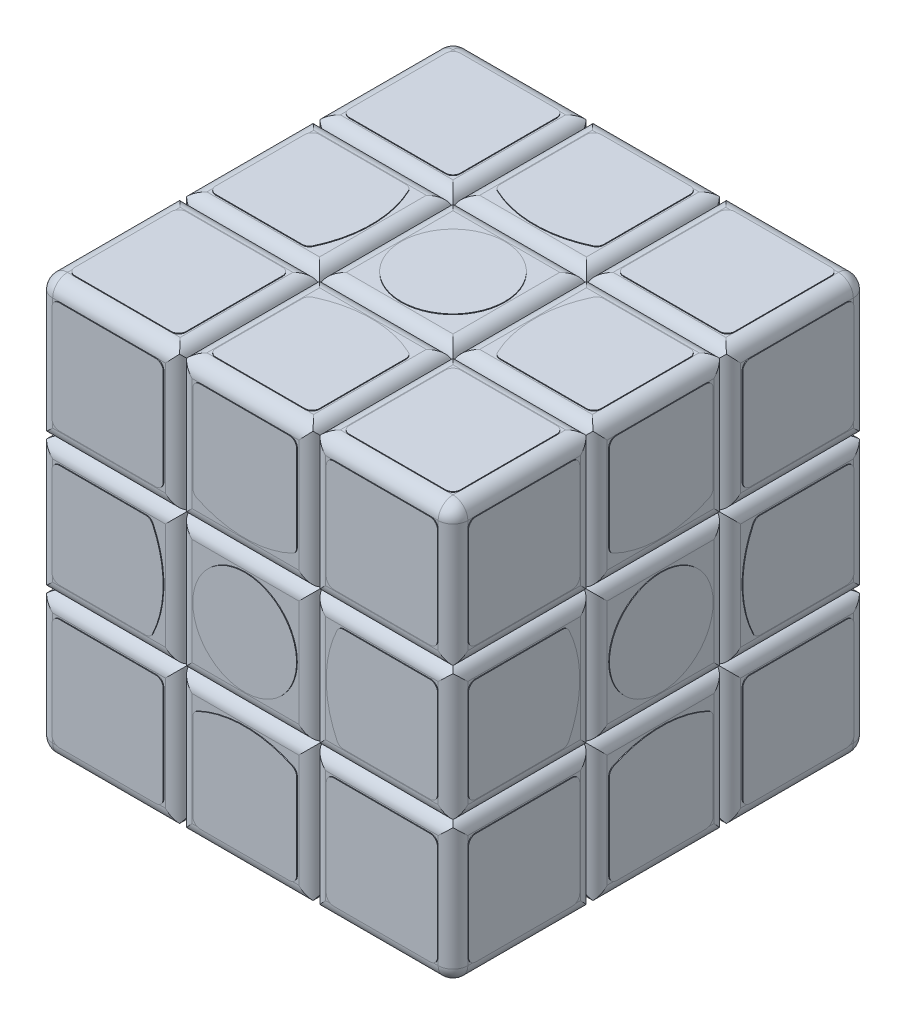
from build123d import *

# Parameters (mm, degrees)
EXTRUDE_1_DEPTH          = 28
FILLET_1_R               = 2
SKETCH_2_R               = 7.000000000000157
EXTRUDE_2_DEPTH          = 0.1
SKETCH_5_R               = 7.000000000000157
EXTRUDE_3_DEPTH          = 0.1
SKETCH_4_R               = 7.000000000000156
EXTRUDE_4_DEPTH          = 0.1
CUT_EXTRUDE_1_DEPTH      = 69.66745954234801
CUT_EXTRUDE_1_DEPTH_BACK = 69.66745954234801
CUT_EXTRUDE_12_DEPTH     = 69.66745962390216
CUT_EXTRUDE_11_DEPTH     = 69.66745962390215


with BuildPart() as part:
    # 草图1 → 凸台-拉伸1 (new, symmetric)
    with BuildSketch(Plane.XY):
        Polygon((27.99999999999999, -27.999999999999982), (-28.00000000000001, -27.99999999999999), (-28.00000000000001, 28.00000000000001), (27.99999999999999, 28.000000000000018), align=None)
    extrude(amount=EXTRUDE_1_DEPTH, both=True)

    # 圆角1
    fillet_1_edges = [part.edges().sort_by_distance(p)[0] for p in [
        (-1.066e-14, 28.000000000000014, 28),
        (-1.066e-14, 28.000000000000014, -28),
        (27.99999999999999, 1.776e-14, 28),
        (-1.066e-14, -27.999999999999986, 28),
        (-28.00000000000001, 1.066e-14, 28),
        (-1.066e-14, -27.999999999999986, -28),
        (27.99999999999999, 1.776e-14, -28),
        (-28.00000000000001, 1.066e-14, -28),
        (27.99999999999999, 28.000000000000018, 0),
        (-28.00000000000001, 28.00000000000001, 0),
        (27.99999999999999, -27.999999999999982, 0),
        (-28.00000000000001, -27.99999999999999, 0),
    ]]
    fillet(fillet_1_edges, radius=FILLET_1_R)

    # 草图2 → 凸台-拉伸2 (add)
    with BuildSketch(Plane(origin=(-3.47e-15, 28.000000000000014, 0), x_dir=(0, 0, -1), z_dir=(-1.6e-16, 1, 0))):
        with BuildLine():
            Line((13.350889359326443, -7.000000000000065), (24.999999999999968, -7.000000000000104))
            ThreePointArc((24.999999999999968, -7.000000000000104), (25.707106781186525, -6.707106781186655), (25.99999999999998, -6.000000000000101))
            Line((25.99999999999998, -6.0000000000001), (26.000000000000025, 5.999999999999917))
            ThreePointArc((26.000000000000025, 5.999999999999917), (25.707106781186575, 6.707106781186473), (25.00000000000002, 6.999999999999928))
            Line((25.00000000000002, 6.999999999999929), (13.35088935932649, 6.999999999999966))
            ThreePointArc((13.35088935932649, 6.999999999999967), (12.816366875501643, 6.8451542547284845), (12.447381456421239, 6.428571428571398))
            ThreePointArc((12.44738145642124, 6.428571428571397), (10.999999999999984, -4.086e-14), (12.447381456421194, -6.428571428571489))
            ThreePointArc((12.447381456421194, -6.42857142857149), (12.816366875501595, -6.8451542547285795), (13.350889359326443, -7.000000000000065))
        make_face()
        with BuildLine():
            Line((26.00000000000033, -24.999999999999666), (26.000000000000323, -11.999999999999664))
            ThreePointArc((26.000000000000323, -11.999999999999664), (25.70710678118687, -11.292893218813116), (25.000000000000323, -10.999999999999664))
            Line((25.000000000000323, -10.999999999999664), (11.999999999999945, -11.00000000000009))
            ThreePointArc((11.999999999999945, -11.00000000000009), (11.292893218813388, -11.29289321881354), (10.99999999999993, -12.000000000000092))
            Line((10.99999999999993, -12.000000000000092), (11.000000000000334, -24.99999999999967))
            ThreePointArc((11.000000000000334, -24.99999999999967), (11.292893218813788, -25.707106781186216), (12.000000000000334, -25.99999999999967))
            Line((12.000000000000334, -25.99999999999967), (25.00000000000033, -25.999999999999666))
            ThreePointArc((25.00000000000033, -25.999999999999666), (25.707106781186877, -25.707106781186212), (26.00000000000033, -24.999999999999666))
        make_face()
        with BuildLine():
            ThreePointArc((25.00000000000004, 10.999999999999934), (25.707106781186596, 11.292893218813383), (26.00000000000005, 11.999999999999936))
            Line((26.00000000000005, 11.999999999999936), (26.000000000000096, 24.999999999999915))
            ThreePointArc((26.000000000000096, 24.999999999999915), (25.707106781186646, 25.70710678118647), (25.000000000000092, 25.999999999999925))
            Line((25.000000000000092, 25.999999999999925), (12.000000000000105, 25.99999999999997))
            ThreePointArc((12.000000000000105, 25.99999999999997), (11.29289321881355, 25.70710678118652), (11.000000000000096, 24.999999999999968))
            Line((11.000000000000094, 24.999999999999968), (11.00000000000005, 11.999999999999986))
            ThreePointArc((11.00000000000005, 11.999999999999986), (11.292893218813498, 11.292893218813429), (12.000000000000053, 10.999999999999975))
            Line((12.000000000000053, 10.999999999999975), (25.00000000000004, 10.999999999999932))
        make_face()
        with BuildLine():
            Line((-5.9999999999992975, -26.000000000000377), (6.0000000000007345, -26.000000000000377))
            ThreePointArc((6.0000000000007345, -26.000000000000377), (6.7071067811872815, -25.707106781186923), (7.000000000000735, -25.000000000000377))
            Line((7.0000000000007345, -25.000000000000377), (6.99999999999992, -13.350889359326514))
            ThreePointArc((6.99999999999992, -13.350889359326514), (6.84515425472844, -12.816366875501664), (6.428571428571355, -12.44738145642126))
            ThreePointArc((6.428571428571354, -12.447381456421262), (-7.86e-14, -11.000000000000403), (-6.428571428571532, -12.447381456421173))
            ThreePointArc((-6.428571428571534, -12.447381456421173), (-6.845154254728624, -12.81636687550157), (-7.00000000000011, -13.350889359326418))
            Line((-7.000000000000111, -13.350889359326418), (-6.999999999999298, -25.000000000000377))
            ThreePointArc((-6.9999999999992975, -25.000000000000377), (-6.707106781185845, -25.707106781186923), (-5.999999999999298, -26.000000000000377))
        make_face()
        with BuildLine():
            ThreePointArc((7.000000000000017, 24.99999999999999), (6.7071067811865674, 25.707106781186546), (6.000000000000011, 26))
            Line((6.000000000000011, 26), (-6.000000000000009, 26.000000000000007))
            ThreePointArc((-6.000000000000009, 26.000000000000007), (-6.707106781186563, 25.70710678118655), (-7.000000000000018, 24.999999999999996))
            Line((-7.000000000000017, 24.999999999999996), (-7.000000000000013, 13.350889359326466))
            ThreePointArc((-7.000000000000013, 13.350889359326466), (-6.845154254728529, 12.816366875501618), (-6.428571428571441, 12.447381456421216))
            ThreePointArc((-6.428571428571441, 12.447381456421214), (4e-15, 10.999999999999982), (6.428571428571448, 12.447381456421219))
            ThreePointArc((6.428571428571447, 12.447381456421217), (6.845154254728535, 12.816366875501618), (7.000000000000019, 13.350889359326468))
            Line((7.000000000000019, 13.350889359326468), (7.000000000000017, 24.99999999999999))
        make_face()
        with BuildLine():
            Line((-24.999999999999677, -26.000000000000004), (-12.000000000000282, -25.999999999999883))
            ThreePointArc((-12.000000000000282, -25.999999999999883), (-11.292893218813726, -25.707106781186436), (-11.000000000000266, -24.999999999999886))
            Line((-11.000000000000266, -24.999999999999886), (-11.00000000000013, -11.999999999999908))
            ThreePointArc((-11.00000000000013, -11.999999999999908), (-11.292893218813573, -11.292893218813349), (-12.000000000000126, -10.99999999999989))
            Line((-12.000000000000126, -10.99999999999989), (-25.000000000000114, -10.999999999999755))
            ThreePointArc((-25.000000000000114, -10.999999999999753), (-25.70710678118667, -11.2928932188132), (-26.00000000000013, -11.999999999999751))
            Line((-26.00000000000013, -11.999999999999751), (-25.999999999999677, -25))
            ThreePointArc((-25.999999999999673, -25), (-25.707106781186226, -25.70710678118655), (-24.999999999999677, -26.000000000000007))
        make_face()
        with BuildLine():
            ThreePointArc((-11.000000000000012, 25), (-11.292893218813468, 25.707106781186557), (-12.000000000000023, 26.00000000000001))
            Line((-12.000000000000023, 26.00000000000001), (-25, 26.00000000000001))
            ThreePointArc((-25, 26.00000000000001), (-25.707106781186557, 25.707106781186557), (-26.00000000000001, 25))
            Line((-26.00000000000001, 25), (-26.00000000000001, 12.000000000000014))
            ThreePointArc((-26.00000000000001, 12.000000000000014), (-25.707106781186557, 11.29289321881346), (-25, 11.000000000000009))
            Line((-25, 11.000000000000009), (-12.000000000000021, 11.000000000000009))
            ThreePointArc((-12.000000000000021, 11.000000000000009), (-11.292893218813465, 11.29289321881346), (-11.000000000000012, 12.000000000000016))
            Line((-11.000000000000012, 12.000000000000016), (-11.000000000000014, 25))
        make_face()
        with BuildLine():
            Line((-25.999999999999936, 6.0000000000002816), (-26.000000000000068, -5.999999999999736))
            ThreePointArc((-26.000000000000068, -5.999999999999736), (-25.707106781186624, -6.707106781186295), (-25.00000000000007, -6.999999999999754))
            Line((-25.00000000000007, -6.999999999999755), (-13.350889359326539, -6.999999999999874))
            ThreePointArc((-13.350889359326539, -6.999999999999874), (-12.81636687550169, -6.845154254728395), (-12.447381456421283, -6.428571428571312))
            ThreePointArc((-12.447381456421285, -6.428571428571312), (-10.999999999999984, 1.1768e-13), (-12.447381456421152, 6.428571428571576))
            ThreePointArc((-12.44738145642115, 6.428571428571577), (-12.816366875501547, 6.845154254728669), (-13.350889359326395, 7.000000000000158))
            Line((-13.350889359326395, 7.000000000000158), (-24.99999999999992, 7.000000000000279))
            ThreePointArc((-24.99999999999992, 7.000000000000278), (-25.707106781186475, 6.707106781186834), (-25.999999999999936, 6.000000000000282))
        make_face()
        Circle(SKETCH_2_R)
    extrude_2 = extrude(amount=EXTRUDE_2_DEPTH)

    # 草图5 → 凸台-拉伸3 (add)
    with BuildSketch(Plane(origin=(0, 0, -28), x_dir=(-1, 0, 0), z_dir=(0, 0, -1))):
        Circle(SKETCH_5_R)
        with BuildLine():
            Line((24.999999999999968, -7.000000000000105), (13.350889359326443, -7.000000000000067))
            ThreePointArc((13.350889359326443, -7.000000000000067), (12.816366875501595, -6.845154254728582), (12.447381456421194, -6.428571428571494))
            ThreePointArc((12.447381456421194, -6.428571428571494), (10.99999999999998, -4.521e-14), (12.447381456421239, 6.428571428571396))
            ThreePointArc((12.447381456421239, 6.428571428571396), (12.816366875501641, 6.845154254728483), (13.35088935932649, 6.9999999999999645))
            Line((13.35088935932649, 6.9999999999999645), (25.00000000000002, 6.999999999999928))
            ThreePointArc((25.00000000000002, 6.999999999999928), (25.707106781186575, 6.707106781186473), (26.000000000000025, 5.9999999999999165))
            Line((26.000000000000025, 5.9999999999999165), (25.99999999999998, -6.000000000000104))
            ThreePointArc((25.99999999999998, -6.000000000000104), (25.70710678118652, -6.707106781186655), (24.999999999999968, -7.000000000000105))
        make_face()
        with BuildLine():
            Line((-25, 26.00000000000001), (-12.000000000000025, 26.00000000000001))
            ThreePointArc((-12.000000000000025, 26.00000000000001), (-11.292893218813468, 25.707106781186557), (-11.000000000000016, 25))
            Line((-11.000000000000016, 25), (-11.000000000000016, 12.000000000000014))
            ThreePointArc((-11.000000000000016, 12.000000000000014), (-11.292893218813468, 11.292893218813457), (-12.000000000000025, 11.000000000000007))
            Line((-12.000000000000025, 11.000000000000007), (-25, 11.000000000000007))
            ThreePointArc((-25, 11.000000000000007), (-25.707106781186557, 11.292893218813456), (-26.00000000000001, 12.000000000000012))
            Line((-26.00000000000001, 12.000000000000012), (-26.00000000000001, 25))
            ThreePointArc((-26.00000000000001, 25), (-25.707106781186557, 25.707106781186557), (-25, 26.00000000000001))
        make_face()
        with BuildLine():
            Line((-6.999999999999298, -25.000000000000377), (-6.999999999999298, -13.350889359326422))
            ThreePointArc((-6.999999999999298, -13.350889359326422), (-6.845154254727811, -12.816366875501574), (-6.428571428570722, -12.447381456421175))
            ThreePointArc((-6.428571428570722, -12.447381456421175), (6.5338e-13, -10.999999999999671), (6.428571428572166, -12.447381456420567))
            ThreePointArc((6.428571428572166, -12.447381456420567), (6.845154254729438, -12.816366875501265), (7.0000000000007345, -13.350889359326516))
            Line((7.0000000000007345, -13.350889359326516), (7.0000000000007345, -25.000000000000377))
            ThreePointArc((7.0000000000007345, -25.000000000000377), (6.7071067811872815, -25.707106781186926), (6.000000000000734, -26.000000000000377))
            Line((6.000000000000734, -26.000000000000377), (-5.9999999999992975, -26.000000000000377))
            ThreePointArc((-5.9999999999992975, -26.000000000000377), (-6.7071067811858445, -25.707106781186923), (-6.999999999999298, -25.000000000000377))
        make_face()
        with BuildLine():
            Line((12.000000000000105, 25.999999999999968), (25.000000000000092, 25.999999999999925))
            ThreePointArc((25.000000000000092, 25.999999999999925), (25.707106781186646, 25.707106781186468), (26.000000000000096, 24.99999999999991))
            Line((26.000000000000096, 24.99999999999991), (26.00000000000005, 11.999999999999934))
            ThreePointArc((26.00000000000005, 11.999999999999934), (25.707106781186596, 11.292893218813381), (25.00000000000004, 10.99999999999993))
            Line((25.00000000000004, 10.99999999999993), (12.000000000000053, 10.999999999999973))
            ThreePointArc((12.000000000000053, 10.999999999999973), (11.292893218813498, 11.292893218813427), (11.00000000000005, 11.999999999999984))
            Line((11.00000000000005, 11.999999999999984), (11.000000000000094, 24.999999999999968))
            ThreePointArc((11.000000000000094, 24.999999999999968), (11.29289321881355, 25.707106781186518), (12.000000000000105, 25.999999999999968))
        make_face()
        with BuildLine():
            Line((26.000000000000323, -11.999999999999666), (26.00000000000033, -24.99999999999967))
            ThreePointArc((26.00000000000033, -24.99999999999967), (25.707106781186877, -25.707106781186216), (25.00000000000033, -25.99999999999967))
            Line((25.00000000000033, -25.99999999999967), (12.000000000000334, -25.99999999999967))
            ThreePointArc((12.000000000000334, -25.99999999999967), (11.292893218813786, -25.707106781186216), (11.000000000000334, -24.99999999999967))
            Line((11.000000000000334, -24.99999999999967), (11.000000000000334, -12.000000000000096))
            ThreePointArc((11.000000000000334, -12.000000000000096), (11.292893218814076, -11.292893218813255), (12.000000000001155, -11.00000000000009))
            Line((12.000000000001155, -11.00000000000009), (25.000000000001535, -11.00000000000009))
            ThreePointArc((25.000000000001535, -11.00000000000009), (25.70710678118721, -11.292893218813761), (26.000000000000323, -11.999999999999666))
        make_face()
        with BuildLine():
            Line((-12.00000000000028, -25.999999999999883), (-24.999999999999677, -26.000000000000004))
            ThreePointArc((-24.999999999999677, -26.000000000000004), (-25.707106781186226, -25.70710678118655), (-25.999999999999677, -25))
            Line((-25.999999999999677, -25), (-25.999999999999677, -11.999999999999755))
            ThreePointArc((-25.999999999999677, -11.999999999999755), (-25.707106781186216, -11.2928932188132), (-24.999999999999655, -10.999999999999755))
            Line((-24.999999999999655, -10.999999999999755), (-11.999999999999671, -10.999999999999755))
            ThreePointArc((-11.999999999999671, -10.999999999999755), (-11.292893218813315, -11.292893218813415), (-11.000000000000128, -11.999999999999908))
            Line((-11.000000000000128, -11.999999999999908), (-11.000000000000266, -24.99999999999989))
            ThreePointArc((-11.000000000000266, -24.99999999999989), (-11.292893218813727, -25.707106781186436), (-12.00000000000028, -25.999999999999883))
        make_face()
        with BuildLine():
            Line((-6.000000000000012, 26.000000000000004), (6.000000000000011, 25.999999999999996))
            ThreePointArc((6.000000000000011, 25.999999999999996), (6.707106781186567, 25.707106781186543), (7.000000000000017, 24.999999999999986))
            Line((7.000000000000017, 24.999999999999986), (7.000000000000019, 13.350889359326466))
            ThreePointArc((7.000000000000019, 13.350889359326466), (6.845154254728535, 12.816366875501616), (6.428571428571447, 12.447381456421216))
            ThreePointArc((6.428571428571447, 12.447381456421216), (2.65e-15, 10.999999999999977), (-6.428571428571443, 12.447381456421214))
            ThreePointArc((-6.428571428571443, 12.447381456421214), (-6.84515425472853, 12.816366875501616), (-7.000000000000013, 13.350889359326464))
            Line((-7.000000000000013, 13.350889359326464), (-7.00000000000002, 24.999999999999993))
            ThreePointArc((-7.00000000000002, 24.999999999999993), (-6.7071067811865674, 25.70710678118655), (-6.000000000000012, 26.000000000000004))
        make_face()
        with BuildLine():
            Line((-24.99999999999992, 7.000000000000277), (-13.350889359326393, 7.000000000000157))
            ThreePointArc((-13.350889359326393, 7.000000000000157), (-12.816366875501547, 6.8451542547286675), (-12.447381456421152, 6.428571428571575))
            ThreePointArc((-12.447381456421152, 6.428571428571575), (-10.99999999999998, 1.1581e-13), (-12.447381456421283, -6.428571428571313))
            ThreePointArc((-12.447381456421283, -6.428571428571313), (-12.81636687550169, -6.845154254728398), (-13.350889359326539, -6.9999999999998765))
            Line((-13.350889359326539, -6.9999999999998765), (-25.00000000000007, -6.999999999999758))
            ThreePointArc((-25.00000000000007, -6.999999999999758), (-25.70710678118662, -6.707106781186296), (-26.000000000000064, -5.999999999999736))
            Line((-26.000000000000064, -5.999999999999736), (-25.99999999999994, 6.0000000000002816))
            ThreePointArc((-25.99999999999994, 6.0000000000002816), (-25.70710678118648, 6.707106781186834), (-24.99999999999992, 7.000000000000277))
        make_face()
    extrude_3 = extrude(amount=EXTRUDE_3_DEPTH)

    # 草图4 → 凸台-拉伸4 (add)
    with BuildSketch(Plane(origin=(27.99999999999999, 0, 0), x_dir=(0, 0, -1), z_dir=(1, 0, 0))):
        Circle(SKETCH_4_R)
        with BuildLine():
            Line((24.999999999999968, -7.000000000000104), (13.350889359326443, -7.000000000000066))
            ThreePointArc((13.350889359326443, -7.000000000000066), (12.816366875501595, -6.845154254728581), (12.447381456421194, -6.428571428571493))
            ThreePointArc((12.447381456421194, -6.428571428571493), (10.99999999999998, -4.521e-14), (12.447381456421239, 6.428571428571396))
            ThreePointArc((12.447381456421239, 6.428571428571396), (12.816366875501641, 6.845154254728483), (13.35088935932649, 6.9999999999999645))
            Line((13.35088935932649, 6.9999999999999645), (25.00000000000002, 6.999999999999928))
            ThreePointArc((25.00000000000002, 6.999999999999928), (25.707106781186575, 6.707106781186473), (26.000000000000025, 5.9999999999999165))
            Line((26.000000000000025, 5.9999999999999165), (25.99999999999998, -6.000000000000103))
            ThreePointArc((25.99999999999998, -6.000000000000103), (25.70710678118652, -6.7071067811866545), (24.999999999999968, -7.000000000000104))
        make_face()
        with BuildLine():
            Line((-25, 26.00000000000001), (-12.000000000000025, 26.00000000000001))
            ThreePointArc((-12.000000000000025, 26.00000000000001), (-11.29289321881347, 25.707106781186553), (-11.000000000000016, 25))
            Line((-11.000000000000016, 25), (-11.000000000000012, 12.000000000000014))
            ThreePointArc((-11.000000000000012, 12.000000000000014), (-11.292893218813465, 11.29289321881346), (-12.000000000000021, 11.000000000000007))
            Line((-12.000000000000021, 11.000000000000007), (-25, 11.000000000000007))
            ThreePointArc((-25, 11.000000000000007), (-25.707106781186557, 11.292893218813457), (-26.00000000000001, 12.000000000000014))
            Line((-26.00000000000001, 12.000000000000014), (-26.00000000000001, 25))
            ThreePointArc((-26.00000000000001, 25), (-25.707106781186557, 25.707106781186557), (-25, 26.00000000000001))
        make_face()
        with BuildLine():
            Line((-6.999999999999298, -25.000000000000377), (-6.999999999999298, -13.35088935932642))
            ThreePointArc((-6.999999999999298, -13.35088935932642), (-6.845154254727811, -12.816366875501572), (-6.428571428570722, -12.447381456421173))
            ThreePointArc((-6.428571428570722, -12.447381456421173), (6.5338e-13, -10.99999999999967), (6.428571428572166, -12.447381456420565))
            ThreePointArc((6.428571428572166, -12.447381456420565), (6.845154254729438, -12.816366875501263), (7.0000000000007345, -13.350889359326514))
            Line((7.0000000000007345, -13.350889359326514), (7.0000000000007345, -25.000000000000377))
            ThreePointArc((7.0000000000007345, -25.000000000000377), (6.7071067811872815, -25.707106781186926), (6.000000000000734, -26.000000000000377))
            Line((6.000000000000734, -26.000000000000377), (-5.9999999999992975, -26.000000000000377))
            ThreePointArc((-5.9999999999992975, -26.000000000000377), (-6.7071067811858445, -25.707106781186923), (-6.999999999999298, -25.000000000000377))
        make_face()
        with BuildLine():
            Line((12.000000000000105, 25.999999999999968), (25.000000000000092, 25.999999999999925))
            ThreePointArc((25.000000000000092, 25.999999999999925), (25.707106781186646, 25.707106781186468), (26.000000000000096, 24.99999999999991))
            Line((26.000000000000096, 24.99999999999991), (26.00000000000005, 11.999999999999934))
            ThreePointArc((26.00000000000005, 11.999999999999934), (25.707106781186596, 11.292893218813381), (25.00000000000004, 10.99999999999993))
            Line((25.00000000000004, 10.99999999999993), (12.000000000000053, 10.999999999999975))
            ThreePointArc((12.000000000000053, 10.999999999999975), (11.292893218813498, 11.292893218813429), (11.00000000000005, 11.999999999999986))
            Line((11.00000000000005, 11.999999999999986), (11.000000000000094, 24.999999999999968))
            ThreePointArc((11.000000000000094, 24.999999999999968), (11.29289321881355, 25.707106781186518), (12.000000000000105, 25.999999999999968))
        make_face()
        with BuildLine():
            Line((26.000000000000323, -11.999999999999664), (26.00000000000033, -24.99999999999967))
            ThreePointArc((26.00000000000033, -24.99999999999967), (25.707106781186877, -25.707106781186216), (25.00000000000033, -25.99999999999967))
            Line((25.00000000000033, -25.99999999999967), (12.000000000000334, -25.99999999999967))
            ThreePointArc((12.000000000000334, -25.99999999999967), (11.292893218813786, -25.707106781186216), (11.000000000000334, -24.99999999999967))
            Line((11.000000000000334, -24.99999999999967), (11.000000000000334, -12.000000000000094))
            ThreePointArc((11.000000000000334, -12.000000000000094), (11.292893218814076, -11.292893218813253), (12.000000000001155, -11.000000000000089))
            Line((12.000000000001155, -11.000000000000089), (25.000000000001535, -11.000000000000089))
            ThreePointArc((25.000000000001535, -11.000000000000089), (25.70710678118721, -11.29289321881376), (26.000000000000323, -11.999999999999664))
        make_face()
        with BuildLine():
            Line((-12.00000000000028, -25.999999999999883), (-24.999999999999677, -26.000000000000004))
            ThreePointArc((-24.999999999999677, -26.000000000000004), (-25.707106781186226, -25.70710678118655), (-25.999999999999677, -25))
            Line((-25.999999999999677, -25), (-25.999999999999677, -11.999999999999753))
            ThreePointArc((-25.999999999999677, -11.999999999999753), (-25.707106781186216, -11.292893218813198), (-24.999999999999655, -10.999999999999753))
            Line((-24.999999999999655, -10.999999999999753), (-11.999999999999671, -10.999999999999753))
            ThreePointArc((-11.999999999999671, -10.999999999999753), (-11.292893218813315, -11.292893218813413), (-11.000000000000128, -11.999999999999906))
            Line((-11.000000000000128, -11.999999999999906), (-11.000000000000266, -24.99999999999989))
            ThreePointArc((-11.000000000000266, -24.99999999999989), (-11.292893218813727, -25.707106781186436), (-12.00000000000028, -25.999999999999883))
        make_face()
        with BuildLine():
            Line((-6.000000000000009, 26.000000000000004), (6.000000000000011, 25.999999999999996))
            ThreePointArc((6.000000000000011, 25.999999999999996), (6.707106781186567, 25.707106781186543), (7.000000000000017, 24.999999999999986))
            Line((7.000000000000017, 24.999999999999986), (7.000000000000019, 13.35088935932647))
            ThreePointArc((7.000000000000019, 13.35088935932647), (6.845154254728535, 12.81636687550162), (6.428571428571447, 12.447381456421217))
            ThreePointArc((6.428571428571447, 12.447381456421217), (2.65e-15, 10.999999999999977), (-6.428571428571443, 12.447381456421214))
            ThreePointArc((-6.428571428571443, 12.447381456421214), (-6.845154254728531, 12.816366875501616), (-7.000000000000013, 13.350889359326466))
            Line((-7.000000000000013, 13.350889359326466), (-7.000000000000017, 24.999999999999993))
            ThreePointArc((-7.000000000000017, 24.999999999999993), (-6.707106781186564, 25.70710678118655), (-6.000000000000009, 26.000000000000004))
        make_face()
        with BuildLine():
            Line((-24.99999999999992, 7.000000000000277), (-13.350889359326393, 7.000000000000157))
            ThreePointArc((-13.350889359326393, 7.000000000000157), (-12.816366875501547, 6.8451542547286675), (-12.447381456421152, 6.428571428571575))
            ThreePointArc((-12.447381456421152, 6.428571428571575), (-10.99999999999998, 1.1664e-13), (-12.447381456421283, -6.4285714285713125))
            ThreePointArc((-12.447381456421283, -6.4285714285713125), (-12.81636687550169, -6.845154254728396), (-13.350889359326539, -6.999999999999876))
            Line((-13.350889359326539, -6.999999999999876), (-25.00000000000007, -6.9999999999997575))
            ThreePointArc((-25.00000000000007, -6.9999999999997575), (-25.70710678118662, -6.707106781186295), (-26.000000000000064, -5.999999999999735))
            Line((-26.000000000000064, -5.999999999999735), (-25.99999999999994, 6.0000000000002816))
            ThreePointArc((-25.99999999999994, 6.0000000000002816), (-25.70710678118648, 6.707106781186834), (-24.99999999999992, 7.000000000000277))
        make_face()
    extrude_4 = extrude(amount=EXTRUDE_4_DEPTH)

    # 草图6 → 切除-拉伸1 (cut, two sides: drawn at the far end of the back side and taken through both)
    with BuildSketch(Plane(origin=(-3.47e-15, 28.000000000000014, 0), x_dir=(1, 1.2e-16, 0), z_dir=(-1.2e-16, 1, 0)).offset(-CUT_EXTRUDE_1_DEPTH_BACK)):
        with BuildLine():
            Line((-7.199999999999923, 28), (-10.799999999999937, 28))
            ThreePointArc((-10.799999999999937, 28), (-9.527207793864145, 27.472792206135793), (-8.999999999999929, 26.200000000000003))
            ThreePointArc((-8.99999999999993, 26.200000000000003), (-8.472792206135715, 27.472792206135793), (-7.199999999999923, 28))
        make_face()
        with BuildLine():
            Line((10.800000000000077, 28), (7.200000000000062, 28))
            ThreePointArc((7.200000000000062, 28), (8.472792206135853, 27.472792206135793), (9.00000000000007, 26.200000000000003))
            ThreePointArc((9.000000000000068, 26.200000000000003), (9.527207793864285, 27.472792206135793), (10.800000000000077, 28))
        make_face()
        with BuildLine():
            Line((27.999999999999968, 7.200000000000874), (27.999999999999964, 10.800000000000887))
            ThreePointArc((27.999999999999964, 10.800000000000887), (27.472792206135757, 9.5272077938651), (26.199999999999974, 9.000000000000883))
            ThreePointArc((26.199999999999974, 9.00000000000088), (27.47279220613576, 8.472792206136663), (27.999999999999968, 7.200000000000874))
        make_face()
        with BuildLine():
            Line((27.999999999999968, -10.799999999999127), (27.999999999999968, -7.199999999999111))
            ThreePointArc((27.999999999999968, -7.199999999999111), (27.47279220613576, -8.472792206134901), (26.199999999999974, -8.999999999999115))
            ThreePointArc((26.199999999999974, -8.999999999999117), (27.472792206135765, -9.527207793863333), (27.999999999999968, -10.799999999999127))
        make_face()
        with BuildLine():
            Line((7.200000000000844, -27.99999999999902), (10.800000000000857, -27.999999999999016))
            ThreePointArc((10.800000000000857, -27.999999999999016), (9.527207793865069, -27.472792206134805), (9.00000000000085, -26.199999999999022))
            ThreePointArc((9.000000000000849, -26.199999999999022), (8.472792206136633, -27.47279220613481), (7.200000000000844, -27.99999999999902))
        make_face()
        with BuildLine():
            Line((-10.799999999999155, -27.99999999999902), (-7.199999999999141, -27.99999999999902))
            ThreePointArc((-7.199999999999141, -27.99999999999902), (-8.472792206134928, -27.472792206134805), (-8.999999999999147, -26.199999999999022))
            ThreePointArc((-8.99999999999915, -26.199999999999022), (-9.527207793863365, -27.47279220613481), (-10.799999999999155, -27.99999999999902))
        make_face()
        with BuildLine():
            Line((-27.99999999999905, -7.199999999999895), (-27.99999999999905, -10.79999999999991))
            ThreePointArc((-27.99999999999905, -10.79999999999991), (-27.472792206134837, -9.527207793864124), (-26.199999999999054, -8.999999999999904))
            ThreePointArc((-26.199999999999054, -8.999999999999902), (-27.47279220613484, -8.472792206135685), (-27.99999999999905, -7.199999999999895))
        make_face()
        with BuildLine():
            Line((-27.999999999999055, 10.800000000000104), (-27.99999999999905, 7.200000000000089))
            ThreePointArc((-27.99999999999905, 7.200000000000089), (-27.472792206134837, 8.472792206135875), (-26.199999999999054, 9.000000000000094))
            ThreePointArc((-26.199999999999054, 9.000000000000094), (-27.472792206134844, 9.527207793864312), (-27.999999999999055, 10.800000000000104))
        make_face()
    extrude(amount=CUT_EXTRUDE_1_DEPTH + CUT_EXTRUDE_1_DEPTH_BACK, mode=Mode.SUBTRACT)

    # 草图12 → 切除-拉伸12 (cut, through all)
    with BuildSketch(Plane(origin=(27.99999999999999, 0, 0), x_dir=(0, 0, -1), z_dir=(1, 0, 0))):
        with BuildLine():
            Line((-10.800000000000685, 27.9999999999998), (-7.200000000000671, 27.9999999999998))
            ThreePointArc((-7.200000000000671, 27.9999999999998), (-8.472792206136461, 27.472792206135594), (-9.000000000000677, 26.199999999999807))
            ThreePointArc((-9.000000000000677, 26.199999999999807), (-9.527207793864894, 27.472792206135598), (-10.800000000000685, 27.9999999999998))
        make_face()
        with BuildLine():
            Line((7.199999999999315, 27.9999999999998), (10.799999999999327, 27.9999999999998))
            ThreePointArc((10.799999999999327, 27.9999999999998), (9.527207793863537, 27.472792206135594), (8.999999999999321, 26.199999999999807))
            ThreePointArc((8.999999999999321, 26.199999999999807), (8.472792206135106, 27.472792206135594), (7.199999999999315, 27.9999999999998))
        make_face()
        with BuildLine():
            Line((27.999999999999215, 10.800000000000686), (27.99999999999922, 7.2000000000006725))
            ThreePointArc((27.99999999999922, 7.2000000000006725), (27.47279220613501, 8.472792206136461), (26.199999999999225, 9.000000000000679))
            ThreePointArc((26.199999999999225, 9.000000000000679), (27.472792206135008, 9.527207793864898), (27.999999999999215, 10.800000000000686))
        make_face()
        with BuildLine():
            Line((27.99999999999922, -7.199999999999313), (27.99999999999922, -10.799999999999327))
            ThreePointArc((27.99999999999922, -10.799999999999327), (27.472792206135015, -9.527207793863536), (26.199999999999225, -8.999999999999318))
            ThreePointArc((26.199999999999225, -8.999999999999318), (27.472792206135008, -8.4727922061351), (27.99999999999922, -7.199999999999313))
        make_face()
        with BuildLine():
            Line((10.800000000000107, -27.99999999999921), (7.200000000000096, -27.99999999999922))
            ThreePointArc((7.200000000000096, -27.99999999999922), (8.472792206135882, -27.472792206135008), (9.000000000000101, -26.199999999999225))
            ThreePointArc((9.000000000000101, -26.199999999999225), (9.52720779386432, -27.472792206135008), (10.800000000000107, -27.99999999999921))
        make_face()
        with BuildLine():
            Line((-7.199999999999891, -27.99999999999922), (-10.799999999999903, -27.99999999999922))
            ThreePointArc((-10.799999999999903, -27.99999999999922), (-9.527207793864116, -27.472792206135008), (-8.999999999999897, -26.199999999999225))
            ThreePointArc((-8.999999999999897, -26.199999999999225), (-8.472792206135678, -27.472792206135008), (-7.199999999999891, -27.99999999999922))
        make_face()
        with BuildLine():
            Line((-27.9999999999998, -10.80000000000011), (-27.9999999999998, -7.200000000000097))
            ThreePointArc((-27.9999999999998, -7.200000000000097), (-27.472792206135587, -8.472792206135885), (-26.199999999999804, -9.000000000000103))
            ThreePointArc((-26.199999999999804, -9.000000000000103), (-27.472792206135587, -9.527207793864322), (-27.9999999999998, -10.80000000000011))
        make_face()
        with BuildLine():
            Line((-27.9999999999998, 7.199999999999889), (-27.9999999999998, 10.799999999999901))
            ThreePointArc((-27.9999999999998, 10.799999999999901), (-27.472792206135594, 9.52720779386411), (-26.199999999999804, 8.999999999999892))
            ThreePointArc((-26.199999999999804, 8.999999999999892), (-27.472792206135587, 8.472792206135676), (-27.9999999999998, 7.199999999999889))
        make_face()
    extrude(amount=-CUT_EXTRUDE_12_DEPTH, mode=Mode.SUBTRACT)

    # 草图13 → 切除-拉伸11 (cut, through all)
    with BuildSketch(Plane(origin=(0, 0, -28), x_dir=(-1, 0, 0), z_dir=(0, 0, -1))):
        with BuildLine():
            ThreePointArc((-9.000000000000677, 26.1999999999998), (-9.527207793864894, 27.47279220613559), (-10.800000000000685, 27.999999999999797))
            Line((-10.800000000000685, 27.999999999999797), (-7.200000000000671, 27.999999999999797))
            ThreePointArc((-7.200000000000671, 27.999999999999797), (-8.472792206136461, 27.472792206135587), (-9.000000000000677, 26.1999999999998))
        make_face()
        with BuildLine():
            ThreePointArc((8.999999999999321, 26.1999999999998), (8.472792206135104, 27.472792206135587), (7.1999999999993145, 27.999999999999797))
            Line((7.1999999999993145, 27.999999999999797), (10.799999999999327, 27.999999999999797))
            ThreePointArc((10.799999999999327, 27.999999999999797), (9.527207793863537, 27.472792206135587), (8.999999999999321, 26.1999999999998))
        make_face()
        with BuildLine():
            ThreePointArc((26.199999999999225, 9.000000000000679), (27.472792206135008, 9.527207793864898), (27.999999999999215, 10.800000000000686))
            Line((27.999999999999215, 10.800000000000686), (27.99999999999922, 7.2000000000006725))
            ThreePointArc((27.99999999999922, 7.2000000000006725), (27.47279220613501, 8.472792206136461), (26.199999999999225, 9.000000000000679))
        make_face()
        with BuildLine():
            ThreePointArc((26.199999999999225, -8.999999999999318), (27.47279220613501, -8.4727922061351), (27.99999999999922, -7.199999999999312))
            Line((27.99999999999922, -7.199999999999312), (27.99999999999922, -10.79999999999933))
            ThreePointArc((27.99999999999922, -10.79999999999933), (27.472792206135015, -9.527207793863536), (26.199999999999225, -8.999999999999318))
        make_face()
        with BuildLine():
            ThreePointArc((9.000000000000101, -26.199999999999225), (9.527207793864317, -27.47279220613501), (10.800000000000107, -27.99999999999922))
            Line((10.800000000000107, -27.99999999999922), (7.200000000000095, -27.99999999999922))
            ThreePointArc((7.200000000000095, -27.99999999999922), (8.472792206135885, -27.47279220613501), (9.000000000000101, -26.199999999999225))
        make_face()
        with BuildLine():
            ThreePointArc((-8.999999999999897, -26.199999999999225), (-8.47279220613568, -27.47279220613501), (-7.19999999999989, -27.99999999999922))
            Line((-7.19999999999989, -27.99999999999922), (-10.799999999999903, -27.99999999999922))
            ThreePointArc((-10.799999999999903, -27.99999999999922), (-9.527207793864113, -27.47279220613501), (-8.999999999999897, -26.199999999999225))
        make_face()
        with BuildLine():
            ThreePointArc((-26.199999999999804, 8.999999999999892), (-27.472792206135587, 8.472792206135676), (-27.9999999999998, 7.199999999999889))
            Line((-27.9999999999998, 7.199999999999889), (-27.9999999999998, 10.799999999999901))
            ThreePointArc((-27.9999999999998, 10.799999999999901), (-27.472792206135594, 9.52720779386411), (-26.199999999999804, 8.999999999999892))
        make_face()
        with BuildLine():
            ThreePointArc((-26.199999999999804, -9.000000000000103), (-27.47279220613559, -9.527207793864322), (-27.9999999999998, -10.800000000000113))
            Line((-27.9999999999998, -10.800000000000113), (-27.9999999999998, -7.200000000000097))
            ThreePointArc((-27.9999999999998, -7.200000000000097), (-27.47279220613559, -8.472792206135885), (-26.199999999999804, -9.000000000000103))
        make_face()
    extrude(amount=-CUT_EXTRUDE_11_DEPTH, mode=Mode.SUBTRACT)

    # 镜向1: 凸台-拉伸3 across plane
    add(extrude_3.mirror(Plane.XY))

    # 镜向2: 凸台-拉伸2 across plane
    add(extrude_2.mirror(Plane.ZX))

    # 镜向3: 凸台-拉伸4 across plane
    add(extrude_4.mirror(Plane(origin=(0, 0, 0), x_dir=(0, 0, 1), z_dir=(1, 0, 0))))


solid = part.part
